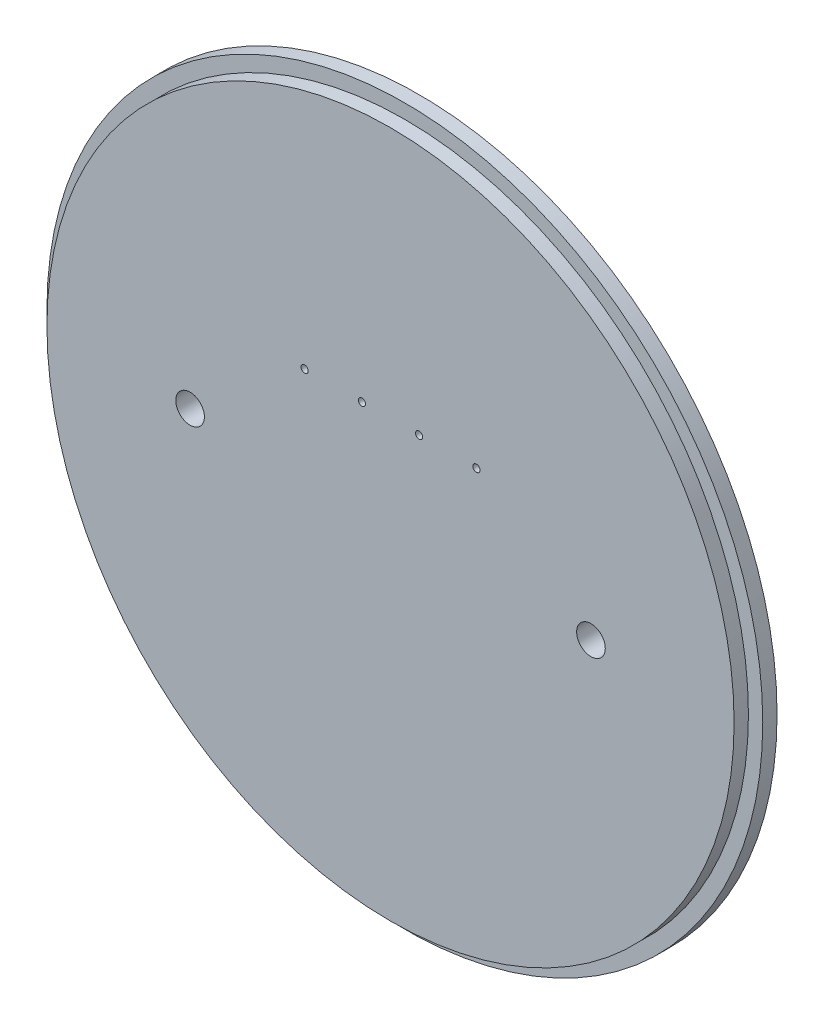
from build123d import *

# Parameters (mm, degrees)
SKETCH1_R                      = 79.375
BOSS_EXTRUDE1_DEPTH            = 3.175
SKETCH2_R                      = 76.2
BOSS_EXTRUDE2_DEPTH            = 3.175
F_1_4_0_25_DIAMETER_HOLE1_D    = 6.35
F_1_16_0_0625_DIAMETER_HOLE1_D = 1.5875


with BuildPart() as part:
    # Sketch1 → Boss-Extrude1 (new body)
    with BuildSketch(Plane.XY):
        Circle(SKETCH1_R)
    extrude(amount=BOSS_EXTRUDE1_DEPTH)

    # Sketch2 → Boss-Extrude2 (add)
    with BuildSketch(Plane.XY.offset(3.175)):
        Circle(SKETCH2_R)
    extrude(amount=BOSS_EXTRUDE2_DEPTH)

    # 1/4 (0.25) Diameter Hole1 (through all)
    with Locations(Plane.XY.offset(6.35)):
        with Locations((-44.45, 0), (44.45, 0)):
            Hole(F_1_4_0_25_DIAMETER_HOLE1_D / 2)

    # 1/16 (0.0625) Diameter Hole1 (through all)
    with Locations(Plane.XY.offset(6.35)):
        with Locations((-19.05, 20.32), (-6.35, 20.32), (6.35, 20.32), (19.05, 20.32)):
            Hole(F_1_16_0_0625_DIAMETER_HOLE1_D / 2)


solid = part.part
